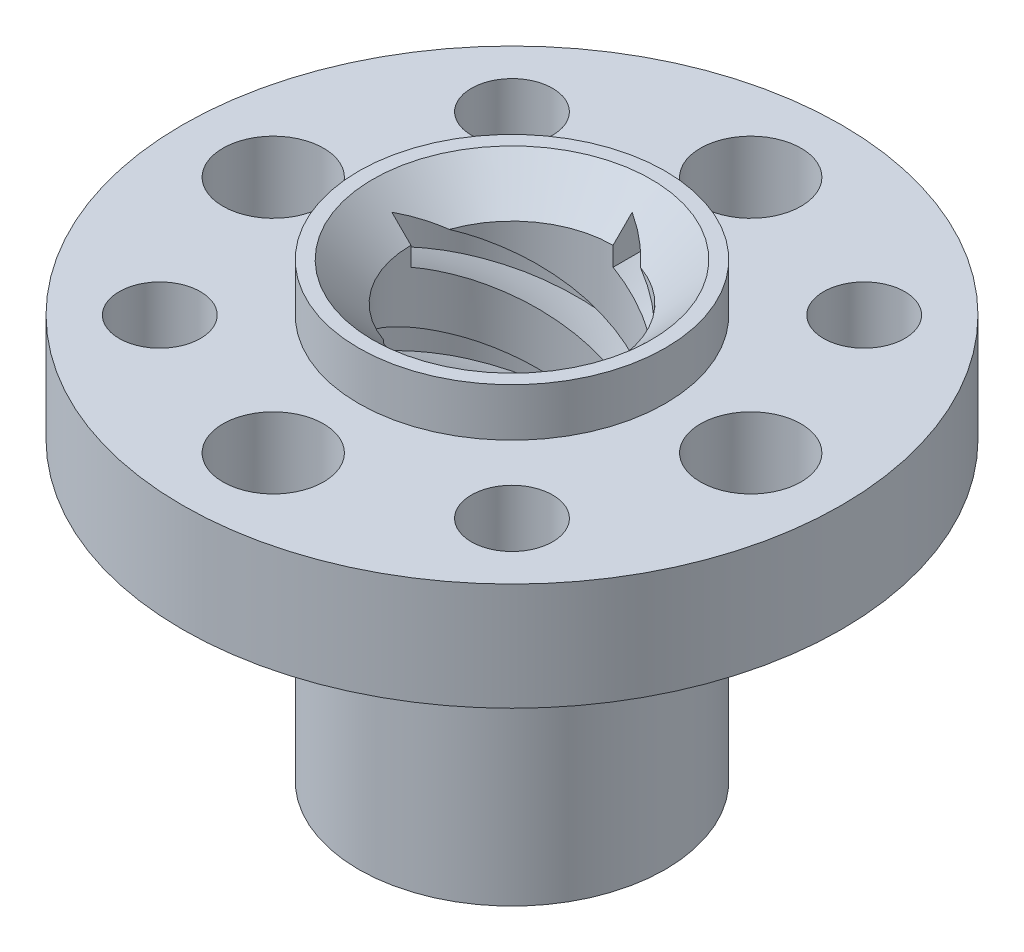
from build123d import *

# Parameters (mm, degrees)
HOLES_REACH           = 22.527
SKETCH2_R             = 1.6764
SHOULDER_R            = 0.254
CHAMFER1_SIZE         = 1.27
CUT_SWEEP1_PITCH      = 12
CIRPATTERN1_COUNT     = 4
F_6_32_TAPPED_HOLE1_D = 2.7051


with BuildPart() as part:
    # Sketch1 → MainBod (revolve)
    with BuildSketch(Plane.XY, mode=Mode.PRIVATE) as mainbod_sk:
        Polygon((3.3655, 15.0368), (5.1054, 15.0368), (5.1054, 13.4366), (10.9728, 13.4366), (10.9728, 9.8552), (5.1054, 9.8552), (5.1054, 0), (3.3655, 0), align=None)
    revolve(mainbod_sk.sketch.rotate(Axis((0, 0, 0), (0, 1, 0)), 90), axis=Axis((0, 0, 0), (0, 1, 0)))

    # Sketch2 → Holes (cut, up to next)
    with BuildSketch(Plane(origin=(0, 13.4366, 0), x_dir=(1, 0, 0), z_dir=(0, 1, 0)), mode=Mode.PRIVATE) as holes_sk1:
        with Locations(Location((7.9502, 0, 0), (0, 0, 270))):
            Circle(SKETCH2_R)
    holes_tool1 = extrude(holes_sk1.sketch, amount=-HOLES_REACH, mode=Mode.PRIVATE) & part.part
    # Sketch2 → Holes (cut, up to next)
    with BuildSketch(Plane(origin=(0, 13.4366, 0), x_dir=(1, 0, 0), z_dir=(0, 1, 0)), mode=Mode.PRIVATE) as holes_sk2:
        with Locations(Location((0, -7.9502, 0), (0, 0, 270))):
            Circle(SKETCH2_R)
    holes_tool2 = extrude(holes_sk2.sketch, amount=-HOLES_REACH, mode=Mode.PRIVATE) & part.part
    # Sketch2 → Holes (cut, up to next)
    with BuildSketch(Plane(origin=(0, 13.4366, 0), x_dir=(1, 0, 0), z_dir=(0, 1, 0)), mode=Mode.PRIVATE) as holes_sk3:
        with Locations(Location((-7.9502, 0, 0), (0, 0, 270))):
            Circle(SKETCH2_R)
    holes_tool3 = extrude(holes_sk3.sketch, amount=-HOLES_REACH, mode=Mode.PRIVATE) & part.part
    # Sketch2 → Holes (cut, up to next)
    with BuildSketch(Plane(origin=(0, 13.4366, 0), x_dir=(1, 0, 0), z_dir=(0, 1, 0)), mode=Mode.PRIVATE) as holes_sk4:
        with Locations(Location((0, 7.9502, 0), (0, 0, 270))):
            Circle(SKETCH2_R)
    holes_tool4 = extrude(holes_sk4.sketch, amount=-HOLES_REACH, mode=Mode.PRIVATE) & part.part
    add(holes_tool1.solids().sort_by_distance((7.9502, 13.4366, 0))[0], mode=Mode.SUBTRACT)
    add(holes_tool2.solids().sort_by_distance((0, 13.4366, 7.9502))[0], mode=Mode.SUBTRACT)
    add(holes_tool3.solids().sort_by_distance((-7.9502, 13.4366, 0))[0], mode=Mode.SUBTRACT)
    add(holes_tool4.solids().sort_by_distance((0, 13.4366, -7.9502))[0], mode=Mode.SUBTRACT)

    # Shoulder
    shoulder_edges = [part.edges().sort_by_distance(p)[0] for p in [
        (0, 9.8552, 5.1054),
    ]]
    fillet(shoulder_edges, radius=SHOULDER_R)

    # Chamfer1
    chamfer1_edges = [part.edges().sort_by_distance(p)[0] for p in [
        (0, 0, 3.3655),
        (0, 15.0368, 3.3655),
    ]]
    chamfer(chamfer1_edges, length=CHAMFER1_SIZE)

    # Cut-Sweep1: the profile of Sketch4 screwed along a right-hand helix of 2 turns, 16 arcs to a turn; built about Z, then put on its axis
    cut_sweep1_z = Axis((0, 0, 0), (0, 0, 1))
    cut_sweep1_corners = [(4.5085, 0, 0.635), (2.2225, 0, 0.635), (2.2225, 0, 1.905), (4.5085, 0, 1.905)]
    with BuildLine(mode=Mode.PRIVATE) as cut_sweep1_profile:
        Line(cut_sweep1_corners[0], cut_sweep1_corners[1])
        Line(cut_sweep1_corners[1], cut_sweep1_corners[2])
        Line(cut_sweep1_corners[2], cut_sweep1_corners[3])
        Line(cut_sweep1_corners[3], cut_sweep1_corners[0])
    cut_sweep1_cap = Face(cut_sweep1_profile.wire())
    cut_sweep1_turn_angles = [0, 11.25, 22.5, 33.75, 45, 56.25, 67.5, 78.75, 90, 101.25, 112.5, 123.75, 135, 146.25, 157.5, 168.75, 180, 191.25, 202.5, 213.75, 225, 236.25, 247.5, 258.75, 270, 281.25, 292.5, 303.75, 315, 326.25, 337.5, 348.75, 360]
    cut_sweep1_turn_weights = [1, 0.9807852804032304, 1, 0.9807852804032304, 1, 0.9807852804032304, 1, 0.9807852804032304, 1, 0.9807852804032304, 1, 0.9807852804032304, 1, 0.9807852804032304, 1, 0.9807852804032304, 1, 0.9807852804032304, 1, 0.9807852804032304, 1, 0.9807852804032304, 1, 0.9807852804032304, 1, 0.9807852804032304, 1, 0.9807852804032304, 1, 0.9807852804032304, 1, 0.9807852804032304, 1]
    cut_sweep1_turn_rails = [Edge.make_bspline([Vector(p[0], p[1], 0).rotate(cut_sweep1_z, cut_sweep1_turn_angles[k]) / cut_sweep1_turn_weights[k] + Vector(0, 0, p[2] + CUT_SWEEP1_PITCH * cut_sweep1_turn_angles[k] / 360) for k in range(33)], [0, 0, 0, 1, 1, 2, 2, 3, 3, 4, 4, 5, 5, 6, 6, 7, 7, 8, 8, 9, 9, 10, 10, 11, 11, 12, 12, 13, 13, 14, 14, 15, 15, 16, 16, 16], 2, cut_sweep1_turn_weights) for p in cut_sweep1_corners]
    cut_sweep1_turn_sides = [Face.make_surface_from_curves(cut_sweep1_turn_rails[p[0]], cut_sweep1_turn_rails[p[1]]) for p in [(0, 1), (1, 2), (2, 3), (3, 0)]]
    cut_sweep1 = Plane(origin=(0, 15.0368, 0), x_dir=(-1, 0, 0), z_dir=(0, -1, 0)) * Solid(Shell([*[p.moved(Location((0, 0, CUT_SWEEP1_PITCH * i))) for i in range(2) for p in cut_sweep1_turn_sides], cut_sweep1_cap, cut_sweep1_cap.rotate(cut_sweep1_z, 720).moved(Location((0, 0, CUT_SWEEP1_PITCH * 720 / 360)))]))
    add(cut_sweep1, mode=Mode.SUBTRACT)

    # CirPattern1: Cut-Sweep1 ×4 about axis
    cirpattern1_axis = Axis((0, 15.0368, 0), (0, -1, 0))
    for i in range(1, CIRPATTERN1_COUNT):
        add(cut_sweep1.rotate(cirpattern1_axis, i * 360 / CIRPATTERN1_COUNT), mode=Mode.SUBTRACT)

    # #6-32 Tapped Hole1 (through all)
    with Locations(Plane(origin=(0, 13.4366, 0), x_dir=(1, 0, 0), z_dir=(0, 1, 0))):
        with Locations((-5.864107247, 5.864107247), (5.864107247, 5.864107247), (5.864107247, -5.864107247), (-5.864107247, -5.864107247)):
            Hole(F_6_32_TAPPED_HOLE1_D / 2)


solid = part.part
